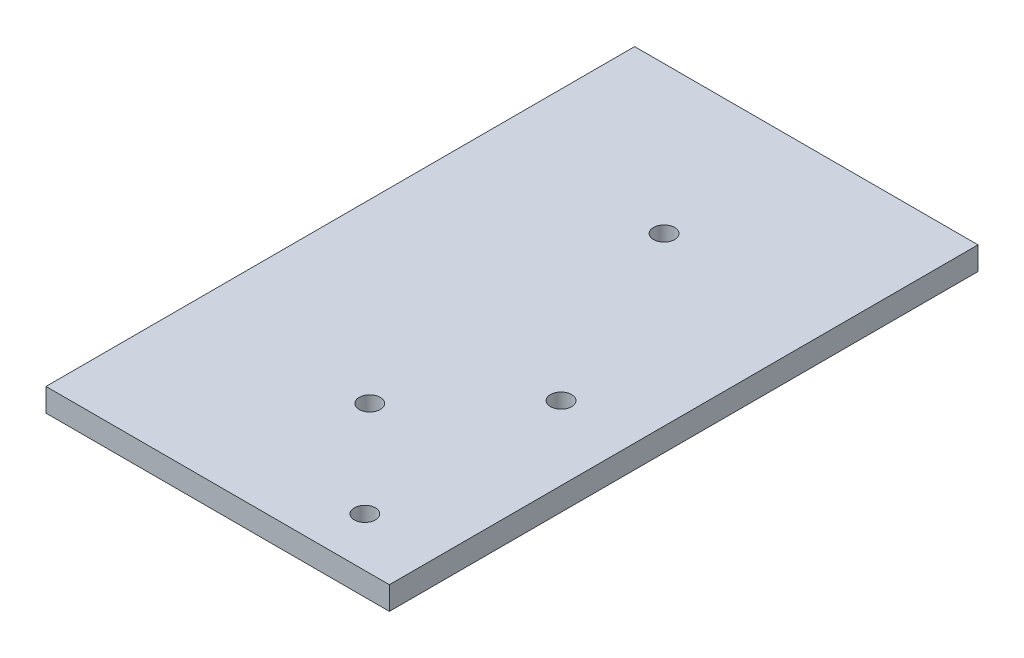
from build123d import *

# Parameters (mm, degrees)
SKETCH2_W               = 88.9
SKETCH2_H               = 152.4
BOSS_EXTRUDE1_DEPTH     = 5.9944
CUT_EXTRUDE2_DEPTH      = 177.535840076
CUT_EXTRUDE2_DEPTH_BACK = 177.535840076
SKETCH4_R               = 2.7305
CUT_EXTRUDE3_DEPTH      = 177.535840076
CUT_EXTRUDE3_DEPTH_BACK = 177.535840076
SKETCH5_R               = 2.7305


with BuildPart() as part:
    # Sketch2 → Boss-Extrude1 (new body)
    with BuildSketch(Plane(origin=(0, 0, 0), x_dir=(1, 0, 0), z_dir=(0, 1, 0))):
        with Locations((44.45, 76.2)):
            Rectangle(SKETCH2_W, SKETCH2_H)
    extrude(amount=BOSS_EXTRUDE1_DEPTH)

    # Sketch4 → Cut-Extrude2 (cut, two sides: drawn at the far end of the back side and taken through both)
    with BuildSketch(Plane(origin=(0, 5.9944, 0), x_dir=(1, 0, 0), z_dir=(0, 1, 0)).offset(-CUT_EXTRUDE2_DEPTH_BACK)):
        with Locations((45.72, 114.3)):
            Circle(SKETCH4_R)
        with Locations((45.72, 38.1)):
            Circle(SKETCH4_R)
    extrude(amount=CUT_EXTRUDE2_DEPTH + CUT_EXTRUDE2_DEPTH_BACK, mode=Mode.SUBTRACT)

    # Sketch5 → Cut-Extrude3 (cut, two sides: drawn at the far end of the back side and taken through both)
    with BuildSketch(Plane(origin=(0, 5.9944, 0), x_dir=(1, 0, 0), z_dir=(0, 1, 0)).offset(-CUT_EXTRUDE3_DEPTH_BACK)):
        with Locations((69.85, 63.5)):
            Circle(SKETCH5_R)
        with Locations((69.85, 12.7)):
            Circle(SKETCH5_R)
    extrude(amount=CUT_EXTRUDE3_DEPTH + CUT_EXTRUDE3_DEPTH_BACK, mode=Mode.SUBTRACT)


solid = part.part
